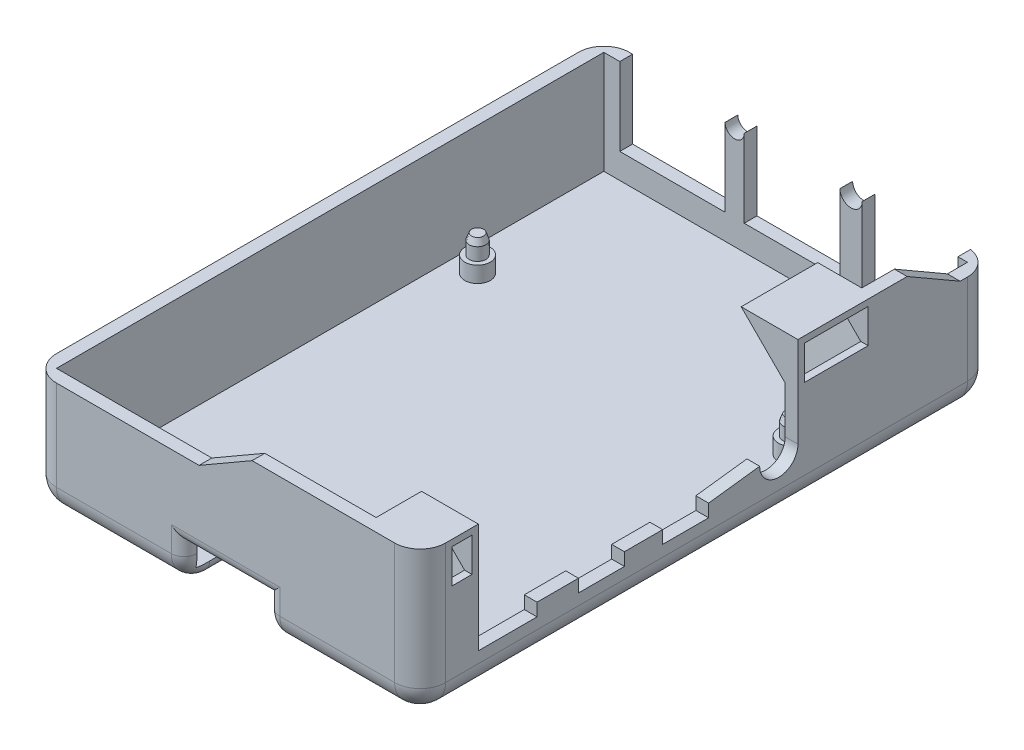
from build123d import *

# Parameters (mm, degrees)
SZKIC1_W                     = 56.2
SZKIC1_H                     = 85
DODANIE_WYCI_GNI_CIE2_DEPTH  = 2
SZKIC2_R                     = 2
DODANIE_WYCI_GNI_CIE5_DEPTH  = 2.5
SZKIC4_R                     = 1.3
DODANIE_WYCI_GNI_CIE6_DEPTH  = 2
SZKIC6_R                     = 1.3
DODANIE_WYCI_GNI_CIE7_DEPTH  = 1
DODANIE_WYCI_GNI_CIE7_TAPER  = 20
SZKIC1_4_W                   = 57
SZKIC1_4_H                   = 85.8
SZKIC1_4_W_2                 = 56.2
SZKIC1_4_H_2                 = 85
DODANIE_WYCI_GNI_CIE3_DEPTH  = 2
SZKIC1_5_W                   = 61
SZKIC1_5_H                   = 89.8
SZKIC1_5_W_2                 = 57
SZKIC1_5_H_2                 = 85.8
DODANIE_WYCI_GNI_CIE4_DEPTH  = 4.5
LUSTRO2_COPY_1_SKETCH_R      = 1.3
LUSTRO2_COPY_1_DEPTH         = 2
LUSTRO2_COPY_2_SKETCH_R      = 1.3
LUSTRO2_COPY_2_DEPTH         = 1
LUSTRO2_COPY_2_TAPER         = 20
SZKIC12_W                    = 13
SZKIC12_H                    = 4.5
WYTNIJ_WYCI_GNI_CIE4_DEPTH   = 10
DODANIE_WYCI_GNI_CIE8_DEPTH  = 1.45
SZKIC14_W                    = 61
SZKIC14_H                    = 89.8
SZKIC14_W_2                  = 57
SZKIC14_H_2                  = 85.8
DODANIE_WYCI_GNI_CIE9_DEPTH  = 17
SZKIC15_W                    = 16.5
SZKIC15_H                    = 17
SZKIC15_W_2                  = 15
WYTNIJ_WYCI_GNI_CIE5_DEPTH   = 2
SZKIC16_W                    = 9.2
SZKIC16_H                    = 11.2
SZKIC16_H_2                  = 2
SZKIC16_W_2                  = 7.2
SZKIC16_W_3                  = 8
SZKIC16_W_4                  = 6
SZKIC16_W_5                  = 6.5
WYTNIJ_WYCI_GNI_CIE6_DEPTH   = 2
ZAOKR_GLENIE1_R              = 4
ZAOKR_GLENIE2_R              = 2
DODANIE_WYCI_GNI_CIE10_DEPTH = 12
WYTNIJ_WYCI_GNI_CIE8_REACH   = 81.144
SZKIC19_W                    = 10
SZKIC19_H                    = 5.333929422
DODANIE_WYCI_GNI_CIE11_DEPTH = 10
SZKIC22_W                    = 4.5
SZKIC22_H                    = 4.795642615
WYTNIJ_WYCI_GNI_CIE10_DEPTH  = 2
SZKIC23_W                    = 87.8
SZKIC23_H                    = 4.795642615
WYTNIJ_WYCI_GNI_CIE11_DEPTH  = 2
SZKIC28_W                    = 2
SZKIC28_H                    = 4.795642615
WYTNIJ_WYCI_GNI_CIE17_DEPTH  = 2
DODANIE_WYCI_GNI_CIE12_DEPTH = 7.125
WYTNIJ_WYCI_GNI_CIE18_REACH  = 81.144
SZKIC30_W                    = 3.125
SZKIC30_H                    = 5.333929422
DODANIE_WYCI_GNI_CIE13_DEPTH = 3.125
WYTNIJ_WYCI_GNI_CIE19_DEPTH  = 3.5


with BuildPart() as part:
    # Szkic1 → Dodanie-wyciągnięcie2 (new body)
    with BuildSketch(Plane(origin=(0, 0, 0), x_dir=(1, 0, 0), z_dir=(0, 1, 0))):
        Rectangle(SZKIC1_W, SZKIC1_H)
    extrude(amount=DODANIE_WYCI_GNI_CIE2_DEPTH)

    # Szkic2 → Dodanie-wyciągnięcie5 (add)
    with BuildSketch(Plane(origin=(0, 2, 0), x_dir=(1, 0, 0), z_dir=(0, 1, 0))):
        with Locations(Location((-24.575, -38.975, 0), (0, 0, 270))):
            Circle(SZKIC2_R)
        with Locations(Location((24.575, -38.975, 0), (0, 0, 270))):
            Circle(SZKIC2_R)
        with Locations(Location((-24.575, 19.175, 0), (0, 0, 270))):
            Circle(SZKIC2_R)
        with Locations(Location((24.575, 19.175, 0), (0, 0, 270))):
            Circle(SZKIC2_R)
    extrude(amount=DODANIE_WYCI_GNI_CIE5_DEPTH)

    # Szkic4 → Dodanie-wyciągnięcie6 (add)
    with BuildSketch(Plane(origin=(0, 4.5, 0), x_dir=(1, 0, 0), z_dir=(0, 1, 0))):
        with Locations(Location((-24.575, 19.175, 0), (0, 0, 270))):
            Circle(SZKIC4_R)
    dodanie_wyci_gni_cie6 = extrude(amount=DODANIE_WYCI_GNI_CIE6_DEPTH)

    # Szkic6 → Dodanie-wyciągnięcie7 (add)
    with BuildSketch(Plane(origin=(0, 6.5, 0), x_dir=(1, 0, 0), z_dir=(0, 1, 0))):
        with Locations(Location((-24.575, 19.175, 0), (0, 0, 270))):
            Circle(SZKIC6_R)
    dodanie_wyci_gni_cie7 = extrude(amount=DODANIE_WYCI_GNI_CIE7_DEPTH, taper=DODANIE_WYCI_GNI_CIE7_TAPER)

    # Szkic1<4> → Dodanie-wyciągnięcie3 (add)
    with BuildSketch(Plane(origin=(0, 0, 0), x_dir=(1, 0, 0), z_dir=(0, 1, 0))):
        Rectangle(SZKIC1_4_W, SZKIC1_4_H)
        Rectangle(SZKIC1_4_W_2, SZKIC1_4_H_2, mode=Mode.SUBTRACT)
    extrude(amount=DODANIE_WYCI_GNI_CIE3_DEPTH)

    # Szkic1<5> → Dodanie-wyciągnięcie4 (add)
    with BuildSketch(Plane(origin=(0, 0, 0), x_dir=(1, 0, 0), z_dir=(0, 1, 0))):
        Rectangle(SZKIC1_5_W, SZKIC1_5_H)
        Rectangle(SZKIC1_5_W_2, SZKIC1_5_H_2, mode=Mode.SUBTRACT)
    extrude(amount=DODANIE_WYCI_GNI_CIE4_DEPTH)

    # Lustro1: Dodanie-wyciągnięcie6, Dodanie-wyciągnięcie7 across plane
    add(dodanie_wyci_gni_cie6.mirror(Plane(origin=(0, 0, 0), x_dir=(0, 0, 1), z_dir=(1, 0, 0))))
    add(dodanie_wyci_gni_cie7.mirror(Plane(origin=(0, 0, 0), x_dir=(0, 0, 1), z_dir=(1, 0, 0))))

    # Lustro2: Dodanie-wyciągnięcie6, Dodanie-wyciągnięcie7 across plane
    add(dodanie_wyci_gni_cie6.mirror(Plane.XY.offset(9.9)))
    add(dodanie_wyci_gni_cie7.mirror(Plane.XY.offset(9.9)))

    # Lustro2 copy 1 sketch → Lustro2 copy 1 (add)
    with BuildSketch(Plane(origin=(0, 4.5, 19.8), x_dir=(-1, 0, 0), z_dir=(0, 1, 0))):
        with Locations(Location((-24.575, 19.175, 0), (0, 0, 270))):
            Circle(LUSTRO2_COPY_1_SKETCH_R)
    extrude(amount=LUSTRO2_COPY_1_DEPTH)

    # Lustro2 copy 2 sketch → Lustro2 copy 2 (add)
    with BuildSketch(Plane(origin=(0, 6.5, 19.8), x_dir=(-1, 0, 0), z_dir=(0, 1, 0))):
        with Locations(Location((-24.575, 19.175, 0), (0, 0, 270))):
            Circle(LUSTRO2_COPY_2_SKETCH_R)
    extrude(amount=LUSTRO2_COPY_2_DEPTH, taper=LUSTRO2_COPY_2_TAPER)

    # Szkic12 → Wytnij-wyciągnięcie4 (cut)
    with BuildSketch(Plane.XY.offset(44.9)):
        with Locations((0, 2.25)):
            Rectangle(SZKIC12_W, SZKIC12_H)
    extrude(amount=-WYTNIJ_WYCI_GNI_CIE4_DEPTH, mode=Mode.SUBTRACT)

    # Szkic13 → Dodanie-wyciągnięcie8 (add)
    with BuildSketch(Plane(origin=(0, 4.5, 0), x_dir=(1, 0, 0), z_dir=(0, 1, 0))):
        Polygon((-6.5, -44.9), (-6.5, -42.9), (-28.5, -42.9), (-28.5, 42.9), (28.5, 42.9), (28.5, -42.9), (6.5, -42.9), (6.5, -44.9), (30.5, -44.9), (30.5, 44.9), (-30.5, 44.9), (-30.5, -44.9), align=None)
    extrude(amount=DODANIE_WYCI_GNI_CIE8_DEPTH)

    # Szkic14 → Dodanie-wyciągnięcie9 (add)
    with BuildSketch(Plane(origin=(0, 5.95, 0), x_dir=(1, 0, 0), z_dir=(0, 1, 0))):
        Rectangle(SZKIC14_W, SZKIC14_H)
        Rectangle(SZKIC14_W_2, SZKIC14_H_2, mode=Mode.SUBTRACT)
    extrude(amount=DODANIE_WYCI_GNI_CIE9_DEPTH)

    # Szkic15 → Wytnij-wyciągnięcie5 (cut)
    with BuildSketch(Plane(origin=(0, 0, -44.9), x_dir=(-1, 0, 0), z_dir=(0, 0, -1))):
        with Locations((17.75, 14.45)):
            Rectangle(SZKIC15_W, SZKIC15_H)
        with Locations((-1, 14.45)):
            Rectangle(SZKIC15_W_2, SZKIC15_H)
        with Locations((-19.5, 14.45)):
            Rectangle(SZKIC15_W_2, SZKIC15_H)
    extrude(amount=-WYTNIJ_WYCI_GNI_CIE5_DEPTH, mode=Mode.SUBTRACT)

    # Szkic16 → Wytnij-wyciągnięcie6 (cut)
    with BuildSketch(Plane(origin=(30.5, 0, 0), x_dir=(0, 0, -1), z_dir=(1, 0, 0))):
        with Locations((-31.175, 17.35)):
            Rectangle(SZKIC16_W, SZKIC16_H)
        with Locations((-31.175, 10.75)):
            Rectangle(SZKIC16_W, SZKIC16_H_2)
        with Locations((-31.175, 8.75)):
            Rectangle(SZKIC16_W, SZKIC16_H_2)
        with Locations((-31.175, 6.75)):
            Rectangle(SZKIC16_W, SZKIC16_H_2)
        with Locations((-16.475, 17.35)):
            Rectangle(SZKIC16_W_2, SZKIC16_H)
        with Locations((-16.475, 10.75)):
            Rectangle(SZKIC16_W_2, SZKIC16_H_2)
        with Locations((-16.475, 8.75)):
            Rectangle(SZKIC16_W_2, SZKIC16_H_2)
        with Locations((-16.475, 6.75)):
            Rectangle(SZKIC16_W_2, SZKIC16_H_2)
        with Locations((-3.275, 17.35)):
            Rectangle(SZKIC16_W_2, SZKIC16_H)
        with Locations((-3.275, 10.75)):
            Rectangle(SZKIC16_W_2, SZKIC16_H_2)
        with Locations((-3.275, 8.75)):
            Rectangle(SZKIC16_W_2, SZKIC16_H_2)
        with Locations((-3.275, 6.75)):
            Rectangle(SZKIC16_W_2, SZKIC16_H_2)
        with Locations((4.325, 17.35)):
            Rectangle(SZKIC16_W_3, SZKIC16_H)
        with Locations((4.325, 10.75)):
            Rectangle(SZKIC16_W_3, SZKIC16_H_2)
        Polygon((8.325, 9.75), (0.325, 9.75), (0.325, 7.75), (8.325, 8.75), align=None)
        with Locations((-9.875, 17.35)):
            Rectangle(SZKIC16_W_4, SZKIC16_H)
        with Locations((-9.875, 10.75)):
            Rectangle(SZKIC16_W_4, SZKIC16_H_2)
        with Locations((-9.875, 8.75)):
            Rectangle(SZKIC16_W_4, SZKIC16_H_2)
        with Locations((-23.325, 17.35)):
            Rectangle(SZKIC16_W_5, SZKIC16_H)
        with Locations((-23.325, 10.75)):
            Rectangle(SZKIC16_W_5, SZKIC16_H_2)
        with Locations((-23.325, 8.75)):
            Rectangle(SZKIC16_W_5, SZKIC16_H_2)
        with BuildLine():
            ThreePointArc((8.496572875, 9.75), (8.368204321, 9.257305936), (8.325, 8.75))
            ThreePointArc((8.325, 8.75), (8.368204321, 8.242694064), (8.496572875, 7.75))
            Line((8.496572875, 7.75), (14.153427125, 7.75))
            ThreePointArc((14.153427125, 7.75), (14.281795679, 8.242694064), (14.325, 8.75))
            ThreePointArc((14.325, 8.75), (14.281795679, 9.257305936), (14.153427125, 9.75))
            Line((14.153427125, 9.75), (8.496572875, 9.75))
        make_face()
        with BuildLine():
            ThreePointArc((14.153427125, 9.75), (13.057050808, 11.199489743), (11.325, 11.75))
            ThreePointArc((11.325, 11.75), (9.592949192, 11.199489743), (8.496572875, 9.75))
            Line((8.496572875, 9.75), (14.153427125, 9.75))
        make_face()
        with BuildLine():
            Line((14.153427125, 7.75), (8.496572875, 7.75))
            ThreePointArc((8.496572875, 7.75), (9.592949174, 6.30051027), (11.324999954, 5.75))
            ThreePointArc((11.324999954, 5.75), (13.057050789, 6.300510244), (14.153427125, 7.75))
        make_face()
        with BuildLine():
            Line((11.325, 11.75), (8.325, 11.75))
            Line((8.325, 11.75), (8.325, 9.75))
            Line((8.325, 9.75), (8.496572875, 9.75))
            ThreePointArc((8.496572875, 9.75), (9.592949192, 11.199489743), (11.325, 11.75))
        make_face()
        with BuildLine():
            Line((14.325, 9.75), (14.325, 11.75))
            Line((14.325, 11.75), (11.325, 11.75))
            ThreePointArc((11.325, 11.75), (13.057050808, 11.199489743), (14.153427125, 9.75))
            Line((14.153427125, 9.75), (14.325, 9.75))
        make_face()
        Polygon((14.325, 22.95), (8.325, 22.95), (8.325, 11.75), (11.325, 11.75), (14.325, 11.75), align=None)
        with BuildLine():
            Line((14.325, 8.75), (14.325, 9.75))
            Line((14.325, 9.75), (14.153427125, 9.75))
            ThreePointArc((14.153427125, 9.75), (14.281795679, 9.257305936), (14.325, 8.75))
        make_face()
        with BuildLine():
            Line((8.496572875, 9.75), (8.325, 9.75))
            Line((8.325, 9.75), (8.325, 8.75))
            ThreePointArc((8.325, 8.75), (8.368204321, 9.257305936), (8.496572875, 9.75))
        make_face()
    extrude(amount=-WYTNIJ_WYCI_GNI_CIE6_DEPTH, mode=Mode.SUBTRACT)

    # Zaokrąglenie1
    zaokr_glenie1_edges = [part.edges().sort_by_distance(p)[0] for p in [
        (-18.5, 0, 44.9),
        (18.5, 0, 44.9),
        (30.5, 0, 0),
        (-30.5, 0, 0),
        (0, 0, -44.9),
        (-30.5, 11.475, -44.9),
        (30.5, 11.475, -44.9),
        (30.5, 11.475, 44.9),
        (-30.5, 11.475, 44.9),
    ]]
    fillet(zaokr_glenie1_edges, radius=ZAOKR_GLENIE1_R)

    # Zaokrąglenie2
    # the kernel refuses this fillet: 2 mm, written as the material it takes off along each edge
    with BuildSketch(Plane(origin=(6.5, 5.95, 44.9), x_dir=(0, 0, -1), z_dir=(0, -1, 0))) as zaokr_glenie2_piece_1:
        with BuildLine():
            CenterArc((ZAOKR_GLENIE2_R, ZAOKR_GLENIE2_R), ZAOKR_GLENIE2_R, 180, 90)
            Line((0, ZAOKR_GLENIE2_R), (0, 0))
            Line((0, 0), (ZAOKR_GLENIE2_R, 0))
        make_face()
    extrude(amount=1.95, mode=Mode.SUBTRACT)
    with BuildSketch(Plane(origin=(-6.5, 5.95, 44.9), x_dir=(0, 0, -1), z_dir=(0, -1, 0))) as zaokr_glenie2_piece_2:
        with BuildLine():
            CenterArc((ZAOKR_GLENIE2_R, -ZAOKR_GLENIE2_R), ZAOKR_GLENIE2_R, 90, 90)
            Line((0, -ZAOKR_GLENIE2_R), (0, 0))
            Line((0, 0), (ZAOKR_GLENIE2_R, 0))
        make_face()
    extrude(amount=1.95, mode=Mode.SUBTRACT)
    with BuildSketch(Plane(origin=(-6.5, 0, 40.9), x_dir=(-1, 0, 0), z_dir=(0, 0, -1))) as zaokr_glenie2_piece_3:
        with BuildLine():
            CenterArc((ZAOKR_GLENIE2_R, ZAOKR_GLENIE2_R), ZAOKR_GLENIE2_R, 180, 90)
            Line((0, ZAOKR_GLENIE2_R), (0, 0))
            Line((0, 0), (ZAOKR_GLENIE2_R, 0))
        make_face()
    extrude(amount=6, mode=Mode.SUBTRACT)
    with BuildSketch(Plane(origin=(-6.5, 5.95, 44.9), x_dir=(0, 1, 0), z_dir=(1, 0, 0))) as zaokr_glenie2_piece_4:
        with BuildLine():
            CenterArc((ZAOKR_GLENIE2_R, -ZAOKR_GLENIE2_R), ZAOKR_GLENIE2_R, 90, 90)
            Line((0, -ZAOKR_GLENIE2_R), (0, 0))
            Line((0, 0), (ZAOKR_GLENIE2_R, 0))
        make_face()
    extrude(amount=13, mode=Mode.SUBTRACT)
    with BuildSketch(Plane(origin=(6.5, 0, 40.9), x_dir=(1, 0, 0), z_dir=(0, 0, -1))) as zaokr_glenie2_piece_5:
        with BuildLine():
            CenterArc((ZAOKR_GLENIE2_R, -ZAOKR_GLENIE2_R), ZAOKR_GLENIE2_R, 90, 90)
            Line((0, -ZAOKR_GLENIE2_R), (0, 0))
            Line((0, 0), (ZAOKR_GLENIE2_R, 0))
        make_face()
    extrude(amount=6, mode=Mode.SUBTRACT)
    with BuildSketch(Plane(origin=(6.5, 4, 40.9), x_dir=(0, -1, 0), z_dir=(0, 0, -1))) as zaokr_glenie2_piece_6:
        with BuildLine():
            CenterArc((4 - ZAOKR_GLENIE2_R, -ZAOKR_GLENIE2_R), ZAOKR_GLENIE2_R, 0, 90)
            Line((4, -ZAOKR_GLENIE2_R), (4, 0))
            Line((4, 0), (4 - ZAOKR_GLENIE2_R, 0))
        make_face()
    revolve(axis=Axis((6.5, 4, 40.9), (-1, 0, 0)), revolution_arc=90, mode=Mode.SUBTRACT)
    with BuildSketch(Plane(origin=(-6.5, 4, 40.9), x_dir=(0, -1, 0), z_dir=(0, 0, -1))) as zaokr_glenie2_piece_7:
        with BuildLine():
            CenterArc((4 - ZAOKR_GLENIE2_R, ZAOKR_GLENIE2_R), ZAOKR_GLENIE2_R, 270, 90)
            Line((4, ZAOKR_GLENIE2_R), (4, 0))
            Line((4, 0), (4 - ZAOKR_GLENIE2_R, 0))
        make_face()
    revolve(axis=Axis((-6.5, 4, 40.9), (-1, 0, 0)), revolution_arc=90, mode=Mode.SUBTRACT)
    with BuildSketch(Plane(origin=(-6.5, 0, 34.9), x_dir=(0, 0, -1), z_dir=(1, 0, 0))) as zaokr_glenie2_piece_8:
        with BuildLine():
            CenterArc((ZAOKR_GLENIE2_R, ZAOKR_GLENIE2_R), ZAOKR_GLENIE2_R, 180, 90)
            Line((0, ZAOKR_GLENIE2_R), (0, 0))
            Line((0, 0), (ZAOKR_GLENIE2_R, 0))
        make_face()
    extrude(amount=13, mode=Mode.SUBTRACT)
    with BuildSketch(Plane(origin=(6.5, 10.95, 44.9), x_dir=(0, 0, -1), z_dir=(0, -1, 0))) as zaokr_glenie2_piece_9a_section:
        with BuildLine():
            CenterArc((ZAOKR_GLENIE2_R, ZAOKR_GLENIE2_R), ZAOKR_GLENIE2_R, 180, 90)
            Line((0, ZAOKR_GLENIE2_R), (0, 0))
            Line((0, 0), (ZAOKR_GLENIE2_R, 0))
        make_face()
    zaokr_glenie2_piece_9a = extrude(amount=6.95, mode=Mode.PRIVATE)
    zaokr_glenie2_piece_9a = split(zaokr_glenie2_piece_9a, bisect_by=Plane(origin=(6.952790229, 5.95, 44.447209771), z_dir=(0, 1, 0)), keep=Keep.TOP, mode=Mode.PRIVATE)
    with BuildSketch(Plane(origin=(-6.5, 5.95, 44.9), x_dir=(0, 1, 0), z_dir=(1, 0, 0))) as zaokr_glenie2_piece_9b_section:
        with BuildLine():
            CenterArc((ZAOKR_GLENIE2_R, -ZAOKR_GLENIE2_R), ZAOKR_GLENIE2_R, 90, 90)
            Line((0, -ZAOKR_GLENIE2_R), (0, 0))
            Line((0, 0), (ZAOKR_GLENIE2_R, 0))
        make_face()
    zaokr_glenie2_piece_9b = extrude(amount=18, mode=Mode.PRIVATE)
    zaokr_glenie2_piece_9b = split(zaokr_glenie2_piece_9b, bisect_by=Plane(origin=(6.5, 6.402790229, 44.447209771), z_dir=(1, 0, 0)), keep=Keep.TOP, mode=Mode.PRIVATE)
    zaokr_glenie2_piece_9 = zaokr_glenie2_piece_9a & zaokr_glenie2_piece_9b
    add(zaokr_glenie2_piece_9, mode=Mode.SUBTRACT)
    with BuildSketch(Plane(origin=(-6.5, 10.95, 44.9), x_dir=(0, 0, -1), z_dir=(0, -1, 0))) as zaokr_glenie2_piece_10a_section:
        with BuildLine():
            CenterArc((ZAOKR_GLENIE2_R, -ZAOKR_GLENIE2_R), ZAOKR_GLENIE2_R, 90, 90)
            Line((0, -ZAOKR_GLENIE2_R), (0, 0))
            Line((0, 0), (ZAOKR_GLENIE2_R, 0))
        make_face()
    zaokr_glenie2_piece_10a = extrude(amount=6.95, mode=Mode.PRIVATE)
    zaokr_glenie2_piece_10a = split(zaokr_glenie2_piece_10a, bisect_by=Plane(origin=(-6.952790229, 5.95, 44.447209771), z_dir=(0, 1, 0)), keep=Keep.TOP, mode=Mode.PRIVATE)
    with BuildSketch(Plane(origin=(-11.5, 5.95, 44.9), x_dir=(0, 1, 0), z_dir=(1, 0, 0))) as zaokr_glenie2_piece_10b_section:
        with BuildLine():
            CenterArc((ZAOKR_GLENIE2_R, -ZAOKR_GLENIE2_R), ZAOKR_GLENIE2_R, 90, 90)
            Line((0, -ZAOKR_GLENIE2_R), (0, 0))
            Line((0, 0), (ZAOKR_GLENIE2_R, 0))
        make_face()
    zaokr_glenie2_piece_10b = extrude(amount=18, mode=Mode.PRIVATE)
    zaokr_glenie2_piece_10b = split(zaokr_glenie2_piece_10b, bisect_by=Plane(origin=(-6.5, 6.402790229, 44.447209771), z_dir=(-1, 0, 0)), keep=Keep.TOP, mode=Mode.PRIVATE)
    zaokr_glenie2_piece_10 = zaokr_glenie2_piece_10a & zaokr_glenie2_piece_10b
    add(zaokr_glenie2_piece_10, mode=Mode.SUBTRACT)
    with BuildSketch(Plane(origin=(-11.5, 0, 34.9), x_dir=(0, 0, -1), z_dir=(1, 0, 0))) as zaokr_glenie2_piece_11a_section:
        with BuildLine():
            CenterArc((ZAOKR_GLENIE2_R, ZAOKR_GLENIE2_R), ZAOKR_GLENIE2_R, 180, 90)
            Line((0, ZAOKR_GLENIE2_R), (0, 0))
            Line((0, 0), (ZAOKR_GLENIE2_R, 0))
        make_face()
    zaokr_glenie2_piece_11a = extrude(amount=18, mode=Mode.PRIVATE)
    zaokr_glenie2_piece_11a = split(zaokr_glenie2_piece_11a, bisect_by=Plane(origin=(-6.5, 0.452790229, 34.447209771), z_dir=(-1, 0, 0)), keep=Keep.TOP, mode=Mode.PRIVATE)
    with BuildSketch(Plane(origin=(-6.5, 0, 40.9), x_dir=(-1, 0, 0), z_dir=(0, 0, -1))) as zaokr_glenie2_piece_11b_section:
        with BuildLine():
            CenterArc((ZAOKR_GLENIE2_R, ZAOKR_GLENIE2_R), ZAOKR_GLENIE2_R, 180, 90)
            Line((0, ZAOKR_GLENIE2_R), (0, 0))
            Line((0, 0), (ZAOKR_GLENIE2_R, 0))
        make_face()
    zaokr_glenie2_piece_11b = extrude(amount=11, mode=Mode.PRIVATE)
    zaokr_glenie2_piece_11b = split(zaokr_glenie2_piece_11b, bisect_by=Plane(origin=(-6.952790229, 0.452790229, 34.9), z_dir=(0, 0, -1)), keep=Keep.TOP, mode=Mode.PRIVATE)
    zaokr_glenie2_piece_11 = zaokr_glenie2_piece_11a & zaokr_glenie2_piece_11b
    add(zaokr_glenie2_piece_11, mode=Mode.SUBTRACT)
    with BuildSketch(Plane(origin=(6.5, 0, 40.9), x_dir=(1, 0, 0), z_dir=(0, 0, -1))) as zaokr_glenie2_piece_12a_section:
        with BuildLine():
            CenterArc((ZAOKR_GLENIE2_R, -ZAOKR_GLENIE2_R), ZAOKR_GLENIE2_R, 90, 90)
            Line((0, -ZAOKR_GLENIE2_R), (0, 0))
            Line((0, 0), (ZAOKR_GLENIE2_R, 0))
        make_face()
    zaokr_glenie2_piece_12a = extrude(amount=11, mode=Mode.PRIVATE)
    zaokr_glenie2_piece_12a = split(zaokr_glenie2_piece_12a, bisect_by=Plane(origin=(6.952790229, 0.452790229, 34.9), z_dir=(0, 0, -1)), keep=Keep.TOP, mode=Mode.PRIVATE)
    with BuildSketch(Plane(origin=(-6.5, 0, 34.9), x_dir=(0, 0, -1), z_dir=(1, 0, 0))) as zaokr_glenie2_piece_12b_section:
        with BuildLine():
            CenterArc((ZAOKR_GLENIE2_R, ZAOKR_GLENIE2_R), ZAOKR_GLENIE2_R, 180, 90)
            Line((0, ZAOKR_GLENIE2_R), (0, 0))
            Line((0, 0), (ZAOKR_GLENIE2_R, 0))
        make_face()
    zaokr_glenie2_piece_12b = extrude(amount=18, mode=Mode.PRIVATE)
    zaokr_glenie2_piece_12b = split(zaokr_glenie2_piece_12b, bisect_by=Plane(origin=(6.5, 0.452790229, 34.447209771), z_dir=(1, 0, 0)), keep=Keep.TOP, mode=Mode.PRIVATE)
    zaokr_glenie2_piece_12 = zaokr_glenie2_piece_12a & zaokr_glenie2_piece_12b
    add(zaokr_glenie2_piece_12, mode=Mode.SUBTRACT)

    # Szkic18 → Dodanie-wyciągnięcie10 (add)
    with BuildSketch(Plane.XY.offset(-14.325)):
        Polygon((28.5, 22.95), (21.6, 22.95), (28.5, 16.05), align=None)
    extrude(amount=-DODANIE_WYCI_GNI_CIE10_DEPTH)

    # Wytnij-wyciągnięcie8: up to this plane
    wytnij_wyci_gni_cie8_end = Plane(origin=(21.6, 22.95, -26.325), z_dir=(-0.7071067811865515, -0.7071067811865436, 0))
    # Szkic19 → Wytnij-wyciągnięcie8 (cut, up to the surface)
    with BuildSketch(Plane(origin=(30.5, 0, 0), x_dir=(0, 0, -1), z_dir=(1, 0, 0)), mode=Mode.PRIVATE) as wytnij_wyci_gni_cie8_sk1:
        with Locations((20.325, 19.283035289)):
            Rectangle(SZKIC19_W, SZKIC19_H)
    wytnij_wyci_gni_cie8_tool1 = split(extrude(wytnij_wyci_gni_cie8_sk1.sketch, amount=-WYTNIJ_WYCI_GNI_CIE8_REACH, mode=Mode.PRIVATE), bisect_by=wytnij_wyci_gni_cie8_end, keep=Keep.BOTH, mode=Mode.PRIVATE)
    add(wytnij_wyci_gni_cie8_tool1.solids().sort_by_distance((30.5, 19.283035, -20.325))[0], mode=Mode.SUBTRACT)

    # Szkic20 → Dodanie-wyciągnięcie11 (add)
    with BuildSketch(Plane.XY.offset(-25.325)):
        Polygon((28.641036203, 17.323177359), (24.014213562, 21.95), (22.6, 21.95), (27.933929422, 16.616070578), (29.348142984, 16.616070578), align=None)
    extrude(amount=DODANIE_WYCI_GNI_CIE11_DEPTH)

    # Szkic22 → Wytnij-wyciągnięcie10 (cut)
    with BuildSketch(Plane(origin=(0, 0, -44.9), x_dir=(-1, 0, 0), z_dir=(0, 0, -1))):
        with BuildLine():
            Line((9.5, 18.154357385), (9.5, 22.95))
            Line((9.5, 22.95), (6.5, 22.95))
            Line((6.5, 22.95), (6.5, 18.154357385))
            ThreePointArc((6.5, 18.154357385), (8, 19.654357385), (9.5, 18.154357385))
        make_face()
        with Locations((28.25, 20.552178693)):
            Rectangle(SZKIC22_W, SZKIC22_H)
        with BuildLine():
            ThreePointArc((-12, 18.154357385), (-10.25, 16.404357385), (-8.5, 18.154357385))
            ThreePointArc((-8.5, 18.154357385), (-10.25, 19.904357385), (-12, 18.154357385))
        make_face()
        with BuildLine():
            ThreePointArc((-12, 18.154357385), (-10.25, 19.904357385), (-8.5, 18.154357385))
            Line((-8.5, 18.154357385), (-8.5, 22.95))
            Line((-8.5, 22.95), (-12, 22.95))
            Line((-12, 22.95), (-12, 18.154357385))
        make_face()
        with BuildLine():
            ThreePointArc((6.5, 18.154357385), (8, 16.654357385), (9.5, 18.154357385))
            Line((9.5, 18.154357385), (6.5, 18.154357385))
        make_face()
        with BuildLine():
            Line((6.5, 18.154357385), (9.5, 18.154357385))
            ThreePointArc((9.5, 18.154357385), (8, 19.654357385), (6.5, 18.154357385))
        make_face()
    extrude(amount=-WYTNIJ_WYCI_GNI_CIE10_DEPTH, mode=Mode.SUBTRACT)

    # Szkic23 → Wytnij-wyciągnięcie11 (cut)
    with BuildSketch(Plane.ZY.offset(30.5)):
        with Locations((1, 20.552178693)):
            Rectangle(SZKIC23_W, SZKIC23_H)
    extrude(amount=-WYTNIJ_WYCI_GNI_CIE11_DEPTH, mode=Mode.SUBTRACT)

    # Szkic28 → Wytnij-wyciągnięcie17 (cut)
    with BuildSketch(Plane.XY.offset(44.9)):
        with Locations((-27.5, 20.552178693)):
            Rectangle(SZKIC28_W, SZKIC28_H)
        Polygon((-26.5, 18.154357385), (-4.153148332, 18.154357385), (0, 20.552178692), (0, 22.95), (-26.5, 22.95), align=None)
        Polygon((0, 22.95), (0, 20.552178692), (4.153148332, 22.95), align=None)
    extrude(amount=-WYTNIJ_WYCI_GNI_CIE17_DEPTH, mode=Mode.SUBTRACT)

    # Szkic29 → Dodanie-wyciągnięcie12 (add)
    with BuildSketch(Plane(origin=(0, 0, 42.9), x_dir=(-1, 0, 0), z_dir=(0, 0, -1))):
        Polygon((-28.5, 22.95), (-28.5, 16.05), (-21.6, 22.95), align=None)
    extrude(amount=DODANIE_WYCI_GNI_CIE12_DEPTH)

    # Wytnij-wyciągnięcie18: up to this plane
    wytnij_wyci_gni_cie18_end = Plane(origin=(28.5, 16.05, 26.01692642), z_dir=(0.7071067811865509, 0.7071067811865441, 0))
    # Szkic30 → Wytnij-wyciągnięcie18 (cut, up to the surface)
    with BuildSketch(Plane(origin=(30.5, 0, 0), x_dir=(0, 0, -1), z_dir=(1, 0, 0)), mode=Mode.PRIVATE) as wytnij_wyci_gni_cie18_sk1:
        with Locations((-38.3375, 19.283035289)):
            Rectangle(SZKIC30_W, SZKIC30_H)
    wytnij_wyci_gni_cie18_tool1 = split(extrude(wytnij_wyci_gni_cie18_sk1.sketch, amount=-WYTNIJ_WYCI_GNI_CIE18_REACH, mode=Mode.PRIVATE), bisect_by=wytnij_wyci_gni_cie18_end, keep=Keep.BOTH, mode=Mode.PRIVATE)
    add(wytnij_wyci_gni_cie18_tool1.solids().sort_by_distance((30.5, 19.283035, 38.3375))[0], mode=Mode.SUBTRACT)

    # Szkic31 → Dodanie-wyciągnięcie13 (add)
    with BuildSketch(Plane(origin=(0, 0, 39.9), x_dir=(-1, 0, 0), z_dir=(0, 0, -1))):
        Polygon((-27.933929422, 16.616070578), (-22.6, 21.95), (-24.014213562, 21.95), (-29.348142984, 16.616070578), align=None)
    extrude(amount=DODANIE_WYCI_GNI_CIE13_DEPTH)

    # Szkic32 → Wytnij-wyciągnięcie19 (cut)
    with BuildSketch(Plane(origin=(30.5, 0, 0), x_dir=(0, 0, -1), z_dir=(1, 0, 0))):
        Polygon((31.443665151, 22.95), (39.749961815, 18.154357385), (44.868626967, 18.154357385), (44.868626967, 22.95), align=None)
    extrude(amount=-WYTNIJ_WYCI_GNI_CIE19_DEPTH, mode=Mode.SUBTRACT)


solid = part.part
